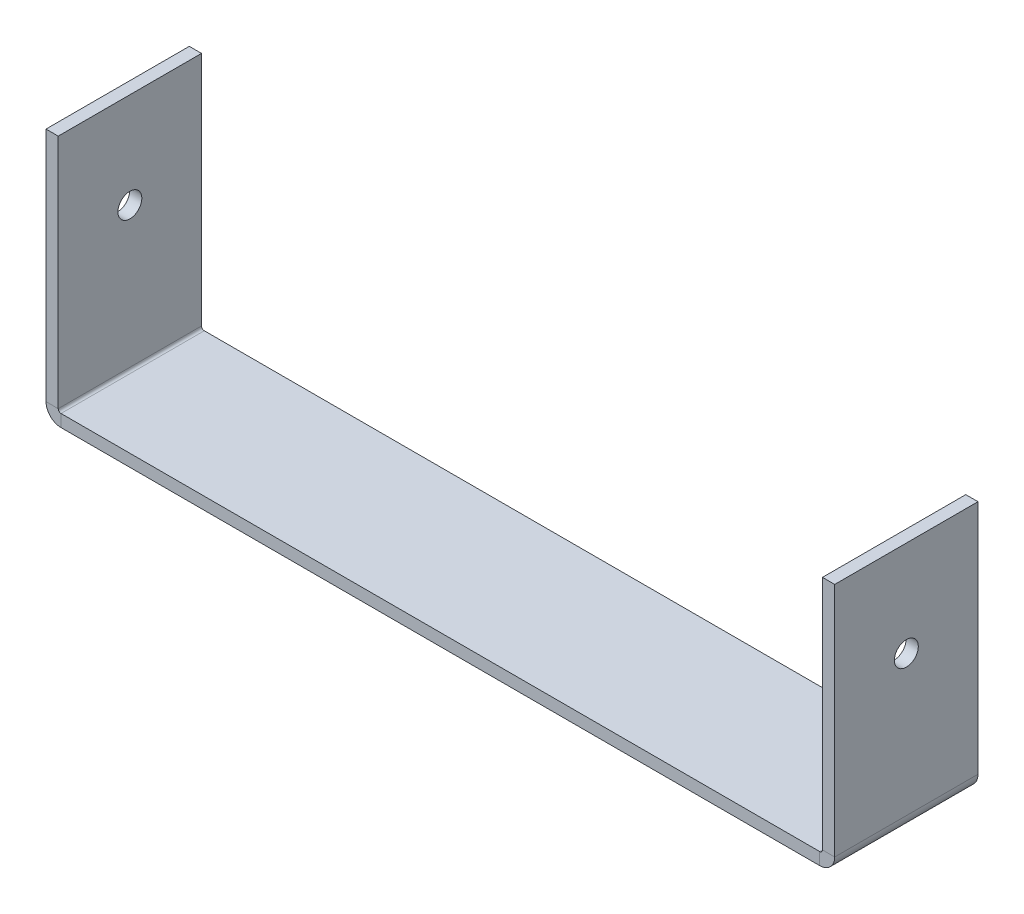
from build123d import *

# Parameters (mm, degrees)
SKETCH1_W                      = 203.2
SKETCH1_H                      = 38.1
BASE_FLANGE1_DEPTH             = 3.2512
EDGE_FLANGE1_STRIP_W           = 14.478
EDGE_FLANGE1_STRIP_H           = 3.2512
EDGE_FLANGE1_STRIP_CUT_DEPTH   = 38.1
EDGE_FLANGE1_STRIP_2_W         = 14.478
EDGE_FLANGE1_STRIP_2_H         = 3.2512
EDGE_FLANGE1_STRIP_CUT_2_DEPTH = 38.1
EDGE_FLANGE1_DEPTH             = 38.1
EDGE_FLANGE1_BEND_DEPTH        = 38.1
SKETCH10_R                     = 3.175
CUT_EXTRUDE1_DEPTH             = 220.932373847


# Sheet-metal steps are written as plain solids
with BuildPart() as part:
    # Sketch1 → Base-Flange1 (new body)
    with BuildSketch(Plane(origin=(0, 0, 0), x_dir=(1, 0, 0), z_dir=(0, 1, 0))):
        Rectangle(SKETCH1_W, SKETCH1_H)
    extrude(amount=-BASE_FLANGE1_DEPTH)

    # Edge-Flange1 strip (across the edge) → Edge-Flange1 strip cut (cut)
    with BuildSketch(Plane(origin=(-101.6, 0, -19.05), x_dir=(1, 0, 0), z_dir=(0, 0, 1))):
        with Locations((-6.5024, -1.6256)):
            Rectangle(EDGE_FLANGE1_STRIP_W, EDGE_FLANGE1_STRIP_H)
    extrude(amount=EDGE_FLANGE1_STRIP_CUT_DEPTH, mode=Mode.SUBTRACT)

    # Edge-Flange1 strip 2 (across the edge) → Edge-Flange1 strip cut 2 (cut)
    with BuildSketch(Plane(origin=(101.6, 0, 19.05), x_dir=(-1, 0, 0), z_dir=(0, 0, -1))):
        with Locations((-6.5024, -1.6256)):
            Rectangle(EDGE_FLANGE1_STRIP_2_W, EDGE_FLANGE1_STRIP_2_H)
    extrude(amount=EDGE_FLANGE1_STRIP_CUT_2_DEPTH, mode=Mode.SUBTRACT)

    # Edge-Flange1 section (across the edge) → Edge-Flange1 (add)
    with BuildSketch(Plane(origin=(-101.6, 0, -19.05), x_dir=(1, 0, 0), z_dir=(0, 0, 1))):
        with BuildLine():
            Line((-3.2512, 0.7366), (-3.2512, 63.5))
            Line((-3.2512, 63.5), (0, 63.5))
            Line((0, 63.5), (0, 0.7366))
            ThreePointArc((0, 0.7366), (0.215745145, 0.215745145), (0.7366, 0))
            Line((0.7366, 0), (0.7366, -3.2512))
            ThreePointArc((0.7366, -3.2512), (-2.083200422, -2.083200422), (-3.2512, 0.7366))
        make_face()
    extrude(amount=EDGE_FLANGE1_DEPTH)

    # Edge-Flange1 section 2 (across the edge) → Edge-Flange1 bend (add)
    with BuildSketch(Plane(origin=(101.6, 0, 19.05), x_dir=(-1, 0, 0), z_dir=(0, 0, -1))):
        with BuildLine():
            Line((-3.2512, 0.7366), (-3.2512, 63.5))
            Line((-3.2512, 63.5), (0, 63.5))
            Line((0, 63.5), (0, 0.7366))
            ThreePointArc((0, 0.7366), (0.215745145, 0.215745145), (0.7366, 0))
            Line((0.7366, 0), (0.7366, -3.2512))
            ThreePointArc((0.7366, -3.2512), (-2.083200422, -2.083200422), (-3.2512, 0.7366))
        make_face()
    extrude(amount=EDGE_FLANGE1_BEND_DEPTH)

    # Sketch10 → Cut-Extrude1 (cut, through all)
    with BuildSketch(Plane.ZY.offset(104.8512)):
        with Locations(Location((0, 38.1, 0), (0, 0, 270))):
            Circle(SKETCH10_R)
    extrude(amount=-CUT_EXTRUDE1_DEPTH, mode=Mode.SUBTRACT)


solid = part.part
